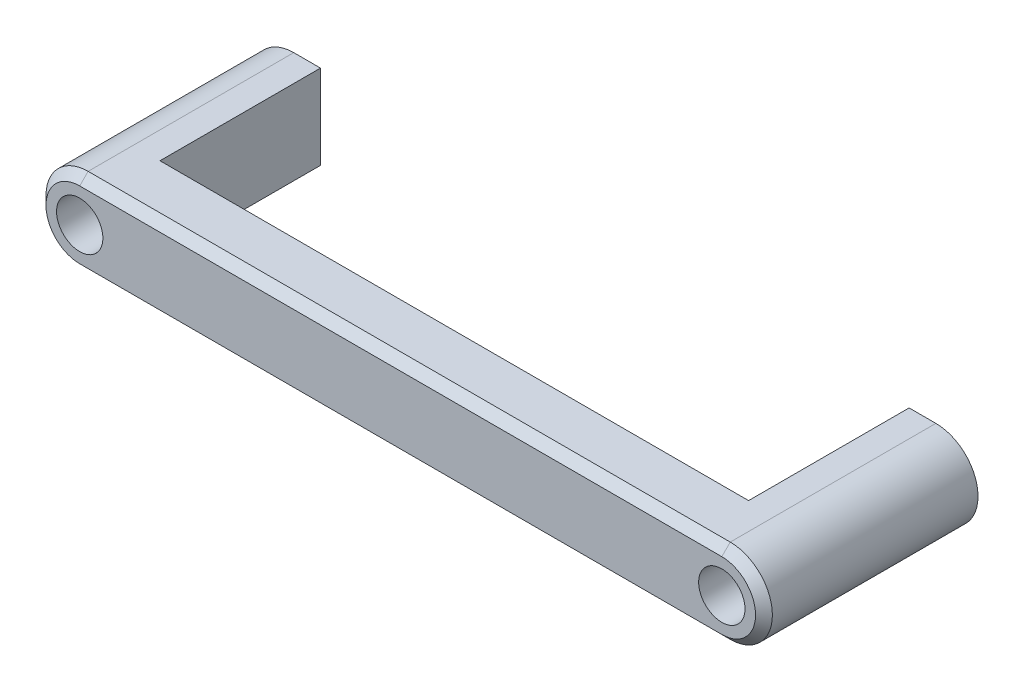
from build123d import *

# Parameters (mm, degrees)
BOSS_EXTRUDE1_DEPTH = 50.8
SKETCH2_R           = 3.75
CUT_EXTRUDE1_DEPTH  = 50.8
SKETCH3_W           = 139.7
SKETCH3_H           = 38.1
CUT_EXTRUDE2_DEPTH  = 50.8
SKETCH4_R           = 5.5
CUT_EXTRUDE3_DEPTH  = 35
CHAMFER1_SIZE       = 2
CHAMFER2_SIZE       = 2


with BuildPart() as part:
    # Sketch1 → Boss-Extrude1 (new body)
    with BuildSketch(Plane.XY):
        with BuildLine():
            Line((-76.2, 10), (76.2, 10))
            ThreePointArc((76.2, 10), (86.2, 0), (76.2, -10))
            Line((76.2, -10), (-76.2, -10))
            ThreePointArc((-76.2, -10), (-86.2, 0), (-76.2, 10))
        make_face()
    extrude(amount=BOSS_EXTRUDE1_DEPTH)

    # Sketch2 → Cut-Extrude1 (cut)
    with BuildSketch(Plane.XY.offset(50.8)):
        with Locations((-76.2, 0)):
            Circle(SKETCH2_R)
        with Locations((76.2, 0)):
            Circle(SKETCH2_R)
    extrude(amount=-CUT_EXTRUDE1_DEPTH, mode=Mode.SUBTRACT)

    # Sketch3 → Cut-Extrude2 (cut)
    with BuildSketch(Plane(origin=(0, 10, 0), x_dir=(1, 0, 0), z_dir=(0, 1, 0))):
        with Locations((0, -19.05)):
            Rectangle(SKETCH3_W, SKETCH3_H)
    extrude(amount=-CUT_EXTRUDE2_DEPTH, mode=Mode.SUBTRACT)

    # Sketch4 → Cut-Extrude3 (cut)
    with BuildSketch(Plane.XY.offset(50.8)):
        with Locations((-76.2, 0)):
            Circle(SKETCH4_R)
        with Locations((76.2, 0)):
            Circle(SKETCH4_R)
    extrude(amount=-CUT_EXTRUDE3_DEPTH, mode=Mode.SUBTRACT)

    # Chamfer1
    chamfer1_edges = [part.edges().sort_by_distance(p)[0] for p in [
        (86.2, 0, 50.8),
        (0, 10, 50.8),
        (-86.2, 0, 50.8),
        (0, -10, 50.8),
    ]]
    chamfer(chamfer1_edges, length=CHAMFER1_SIZE)

    # Chamfer2
    # the kernel refuses this chamfer: 2 mm, written as the material it takes off along each edge
    with BuildSketch(Plane(origin=(76.2, 0, 15.8), x_dir=(1, 0, 0), z_dir=(0, -1, 0))) as chamfer2_piece_1_section:
        Polygon((3.75, -CHAMFER2_SIZE), (3.75 + CHAMFER2_SIZE, 0), (3.75, 0), align=None)
    chamfer2_piece_1 = revolve(axis=Axis((76.2, 0, 15.8), (0, 0, 1)), mode=Mode.PRIVATE)
    chamfer2_piece_1 = chamfer2_piece_1 & Plane(origin=(76.2, 0, 14.674245927), x_dir=(1, 0, 0), z_dir=(0, 0, 1)) * Cylinder(5.5, 23, mode=Mode.PRIVATE)
    add(chamfer2_piece_1, mode=Mode.SUBTRACT)
    with BuildSketch(Plane(origin=(-76.2, 0, 15.8), x_dir=(1, 0, 0), z_dir=(0, -1, 0))) as chamfer2_piece_2_section:
        Polygon((3.75, -CHAMFER2_SIZE), (3.75 + CHAMFER2_SIZE, 0), (3.75, 0), align=None)
    chamfer2_piece_2 = revolve(axis=Axis((-76.2, 0, 15.8), (0, 0, 1)), mode=Mode.PRIVATE)
    chamfer2_piece_2 = chamfer2_piece_2 & Plane(origin=(-76.2, 0, 14.674245927), x_dir=(1, 0, 0), z_dir=(0, 0, 1)) * Cylinder(5.5, 23, mode=Mode.PRIVATE)
    add(chamfer2_piece_2, mode=Mode.SUBTRACT)


solid = part.part
